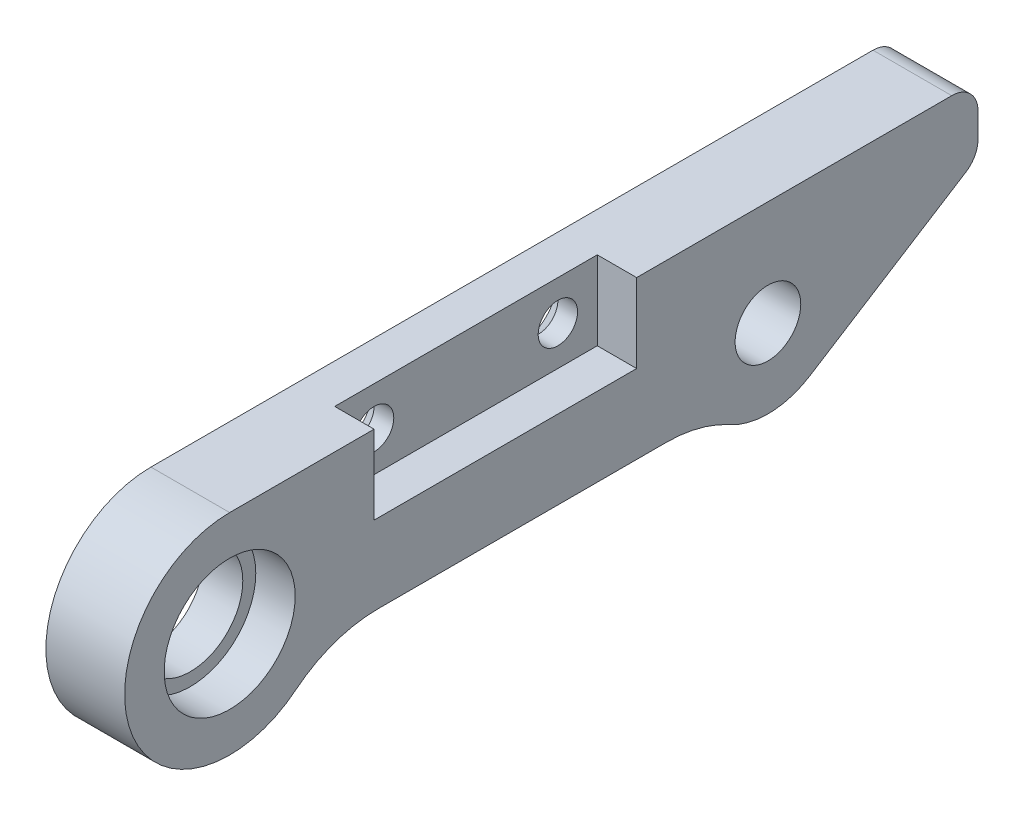
from build123d import *

# Parameters (mm, degrees)
SKETCH27_R          = 4
SKETCH27_R_2        = 2.5
BOSS_EXTRUDE1_DEPTH = 6
SKETCH33_R          = 4.99
CUT_EXTRUDE2_DEPTH  = 3
SKETCH34_W          = 20
SKETCH34_H          = 6
CUT_EXTRUDE3_DEPTH  = 3
CUT_EXTRUDE5_REACH  = 84.855
SKETCH36_R          = 1.5
FILLET3_R           = 2
FILLET4_R           = 10
CUT_EXTRUDE6_REACH  = 85.018
CHAMFER1_SIZE       = 1.5


with BuildPart() as part:
    # Sketch27 → Boss-Extrude1 (new body)
    with BuildSketch(Plane(origin=(0, 0, 0), x_dir=(0, 0, -1), z_dir=(1, 0, 0))):
        with BuildLine():
            Line((9, 50), (66, 50))
            Line((66, 50), (66, 45))
            Line((66, 45), (48.564398788, 34))
            Line((48.564398788, 34), (9, 34))
            ThreePointArc((9, 34), (1, 42), (9, 50))
        make_face()
        with Locations((9, 42)):
            Circle(SKETCH27_R, mode=Mode.SUBTRACT)
        with Locations((50, 42)):
            Circle(SKETCH27_R_2, mode=Mode.SUBTRACT)
    extrude(amount=BOSS_EXTRUDE1_DEPTH)

    # Sketch33 → Cut-Extrude2 (cut)
    with BuildSketch(Plane(origin=(6, 0, 0), x_dir=(0, 0, -1), z_dir=(1, 0, 0))):
        with Locations((9, 42)):
            Circle(SKETCH33_R)
    extrude(amount=-CUT_EXTRUDE2_DEPTH, mode=Mode.SUBTRACT)

    # Sketch34 → Cut-Extrude3 (cut)
    with BuildSketch(Plane(origin=(6, 0, 0), x_dir=(0, 0, -1), z_dir=(1, 0, 0))):
        with Locations((30, 47)):
            Rectangle(SKETCH34_W, SKETCH34_H)
    extrude(amount=-CUT_EXTRUDE3_DEPTH, mode=Mode.SUBTRACT)

    # Sketch36 → Cut-Extrude5 (cut, up to next)
    with BuildSketch(Plane(origin=(3, 0, 0), x_dir=(0, 0, -1), z_dir=(1, 0, 0)), mode=Mode.PRIVATE) as cut_extrude5_sk1:
        with Locations((23, 47)):
            Circle(SKETCH36_R)
    cut_extrude5_tool1 = extrude(cut_extrude5_sk1.sketch, amount=-CUT_EXTRUDE5_REACH, mode=Mode.PRIVATE) & part.part
    # Sketch36 → Cut-Extrude5 (cut, up to next)
    with BuildSketch(Plane(origin=(3, 0, 0), x_dir=(0, 0, -1), z_dir=(1, 0, 0)), mode=Mode.PRIVATE) as cut_extrude5_sk2:
        with Locations((37, 47)):
            Circle(SKETCH36_R)
    cut_extrude5_tool2 = extrude(cut_extrude5_sk2.sketch, amount=-CUT_EXTRUDE5_REACH, mode=Mode.PRIVATE) & part.part
    add(cut_extrude5_tool1.solids().sort_by_distance((3, 47, -23))[0], mode=Mode.SUBTRACT)
    add(cut_extrude5_tool2.solids().sort_by_distance((3, 47, -37))[0], mode=Mode.SUBTRACT)

    # Fillet3
    fillet3_edges = [part.edges().sort_by_distance(p)[0] for p in [
        (3, 50, -66),
        (3, 45, -66),
    ]]
    fillet(fillet3_edges, radius=FILLET3_R)

    # Fillet4
    fillet4_edges = [part.edges().sort_by_distance(p)[0] for p in [
        (3, 34, -48.564398788),
    ]]
    fillet(fillet4_edges, radius=FILLET4_R)

    # Sketch37 → Cut-Extrude6 (cut, up to next)
    with BuildSketch(Plane(origin=(6, 0, 0), x_dir=(0, 0, -1), z_dir=(1, 0, 0)), mode=Mode.PRIVATE) as cut_extrude6_sk1:
        with BuildLine():
            Line((20.313708499, 38), (42.254033308, 38))
            ThreePointArc((42.254033308, 38), (44.754033308, 37.682458366), (47.09526249, 36.75))
            ThreePointArc((47.09526249, 36.75), (50.17237218, 36.002476525), (53.201469536, 36.925495807))
            Line((53.201469536, 36.925495807), (53.201469536, 34))
            Line((53.201469536, 34), (9, 34))
            ThreePointArc((9, 34), (11.666666667, 34.457527667), (14.028314888, 35.777777778))
            ThreePointArc((14.028314888, 35.777777778), (16.980375166, 37.428090416), (20.313708499, 38))
        make_face()
    cut_extrude6_tool1 = extrude(cut_extrude6_sk1.sketch, amount=-CUT_EXTRUDE6_REACH, mode=Mode.PRIVATE) & part.part
    add(cut_extrude6_tool1.solids().sort_by_distance((6, 35.823598, -32.372789))[0], mode=Mode.SUBTRACT)

    # Chamfer1
    chamfer1_edges = [part.edges().sort_by_distance(p)[0] for p in [
        (0, 47, -21.5),
        (0, 47, -35.5),
    ]]
    chamfer(chamfer1_edges, length=CHAMFER1_SIZE - 0.0001)  # a hair under: the kernel refuses the full size


solid = part.part
